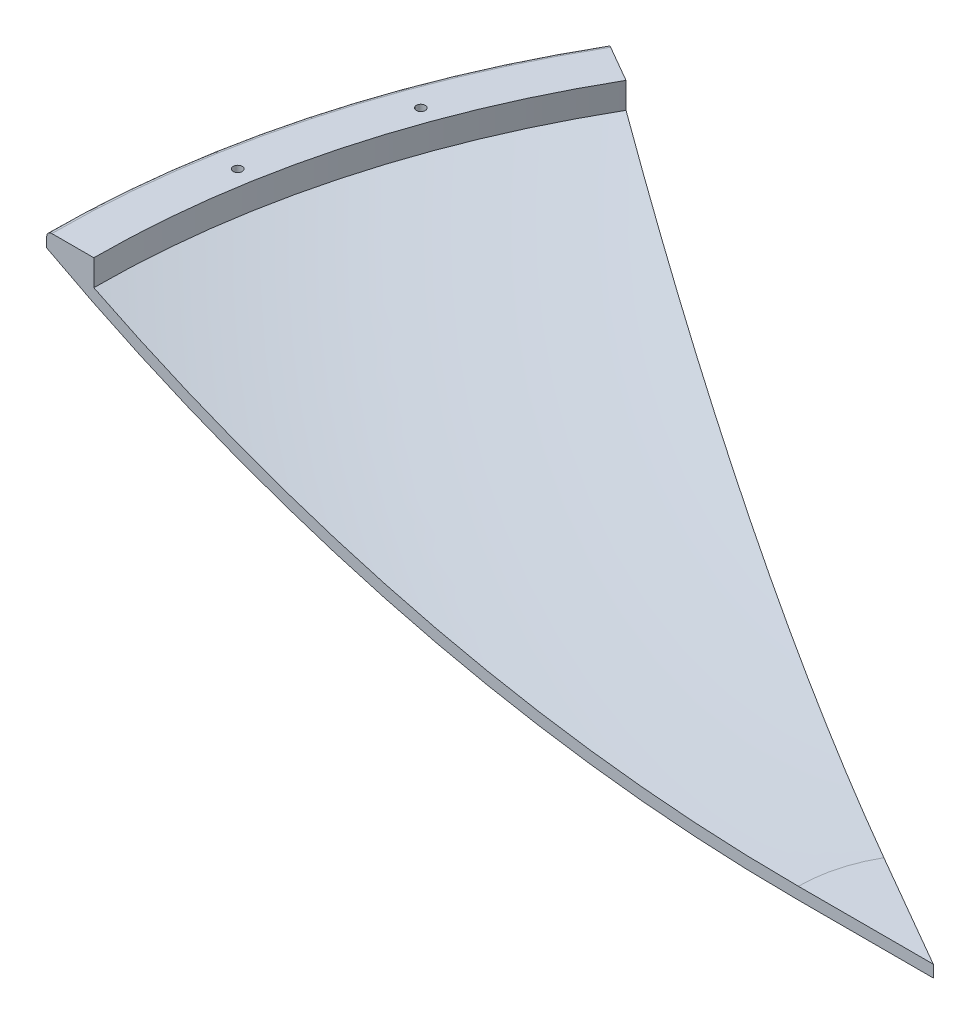
from build123d import *

# Parameters (mm, degrees)
REVOLVE1_ANGLE     = 30
SKETCH2_R          = 1.5
CUT_EXTRUDE1_DEPTH = 338.534270455


with BuildPart() as part:
    # Sketch1 → Revolve1 (revolve)
    with BuildSketch(Plane.XY):
        with BuildLine():
            Line((-45, -150.706887868), (0, -150.706887868))
            Line((0, -150.706887868), (0, -146.706887868))
            Line((0, -146.706887868), (-45, -146.706887868))
            ThreePointArc((-45, -146.706887868), (-165.720333027, -132.670951063), (-280, -91.311985349))
            Line((-280, -91.311985349), (-280, -82.653443934))
            Line((-280, -82.653443934), (-294, -82.653443934))
            ThreePointArc((-294, -82.653443934), (-295.202081528, -83.151362406), (-295.7, -84.353443934))
            Line((-295.7, -84.353443934), (-295.7, -87.525600065))
            Line((-295.7, -87.525600065), (-295.7, -87.686723881))
            ThreePointArc((-295.7, -87.686723881), (-174.249788268, -134.710521753), (-45, -150.706887868))
        make_face()
    revolve(axis=Axis((0, 0, 0), (0, -1, 0)), revolution_arc=REVOLVE1_ANGLE)

    # Sketch2 → Cut-Extrude1 (cut, through all)
    with BuildSketch(Plane(origin=(0, -82.653443934, 0), x_dir=(1, 0, 0), z_dir=(0, 1, 0))):
        with Locations((-281.655017361, 49.663378813)):
            Circle(SKETCH2_R)
        with Locations((-268.752089545, 97.817760991)):
            Circle(SKETCH2_R)
    extrude(amount=-CUT_EXTRUDE1_DEPTH, mode=Mode.SUBTRACT)


solid = part.part
